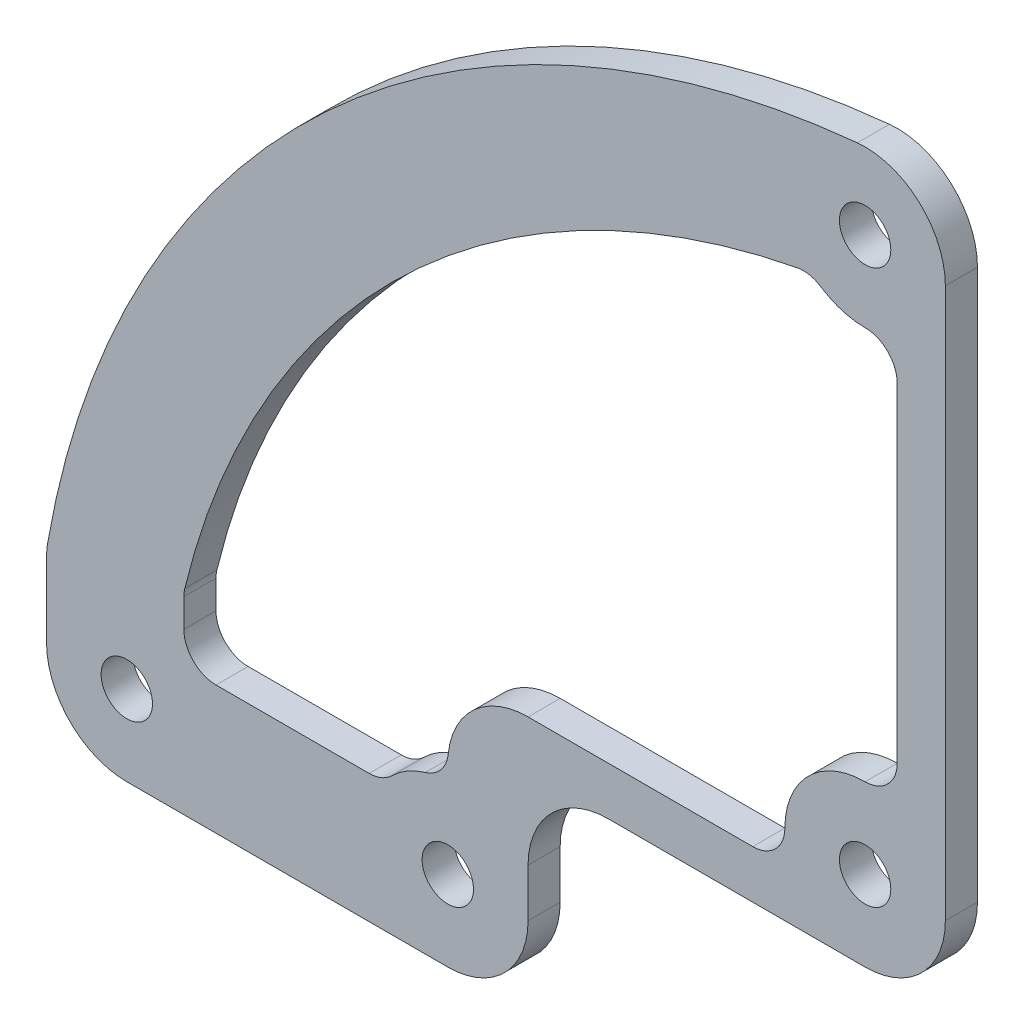
from build123d import *

# Parameters (mm, degrees)
SKETCH_1_R      = 1.6
EXTRUDE_1_DEPTH = 2
FILLET_1_R      = 5
FILLET_2_R      = 2


with BuildPart() as part:
    # ｽｹｯﾁ1 → ﾎﾞｽ - 押し出し1 (new body)
    with BuildSketch(Plane.XY):
        with BuildLine():
            Line((-30, 10), (-30, 0))
            Line((-30, 0), (0, 0))
            Line((0, 0), (0, 13))
            Line((0, 13), (26, 13))
            Line((26, 13), (26, 57.5))
            ThreePointArc((26, 57.5), (-10.715970639, 44.025670649), (-30, 10))
        make_face()
        with Locations((-25, 5)):
            Circle(SKETCH_1_R, mode=Mode.SUBTRACT)
        with Locations((-5, 5)):
            Circle(SKETCH_1_R, mode=Mode.SUBTRACT)
        with Locations((21, 18)):
            Circle(SKETCH_1_R, mode=Mode.SUBTRACT)
        with Locations((21, 52.5)):
            Circle(SKETCH_1_R, mode=Mode.SUBTRACT)
        with BuildLine():
            Line((-5, 11), (-5, 10))
            ThreePointArc((-5, 10), (-7.236067977, 9.472135955), (-9, 8))
            Line((-9, 8), (-21.442485956, 8))
            Line((-21.442485956, 8), (-21.442485956, 12))
            ThreePointArc((-21.442485956, 12), (-7.409474557, 36.255609967), (17.657876922, 48.781100521))
            ThreePointArc((17.657876922, 48.781100521), (19.210376771, 47.83124763), (21, 47.5))
            Line((21, 47.5), (23, 47.5))
            Line((23, 47.5), (23, 23))
            Line((23, 23), (21, 23))
            ThreePointArc((21, 23), (17.464466094, 21.535533906), (16, 18))
            Line((16, 18), (16, 16))
            Line((16, 16), (0, 16))
            ThreePointArc((0, 16), (-3.535533906, 14.535533906), (-5, 11))
        make_face(mode=Mode.SUBTRACT)
    extrude(amount=EXTRUDE_1_DEPTH)

    # ﾌｨﾚｯﾄ1
    fillet_1_edges = [part.edges().sort_by_distance(p)[0] for p in [
        (26, 57.5, 1),
        (26, 13, 1),
        (0, 13, 1),
        (0, 0, 1),
        (-30, 0, 1),
        (-30, 10, 1),
    ]]
    fillet(fillet_1_edges, radius=FILLET_1_R)

    # ﾌｨﾚｯﾄ2
    fillet_2_edges = [part.edges().sort_by_distance(p)[0] for p in [
        (17.657876922, 48.781100521, 1),
        (23, 47.5, 1),
        (16, 16, 1),
        (23, 23, 1),
        (-5, 10, 1),
        (-9, 8, 1),
        (-21.442485956, 8, 1),
        (-21.442485956, 12, 1),
    ]]
    fillet(fillet_2_edges, radius=FILLET_2_R - 0.0001)  # a hair under: the kernel refuses the full size


solid = part.part
